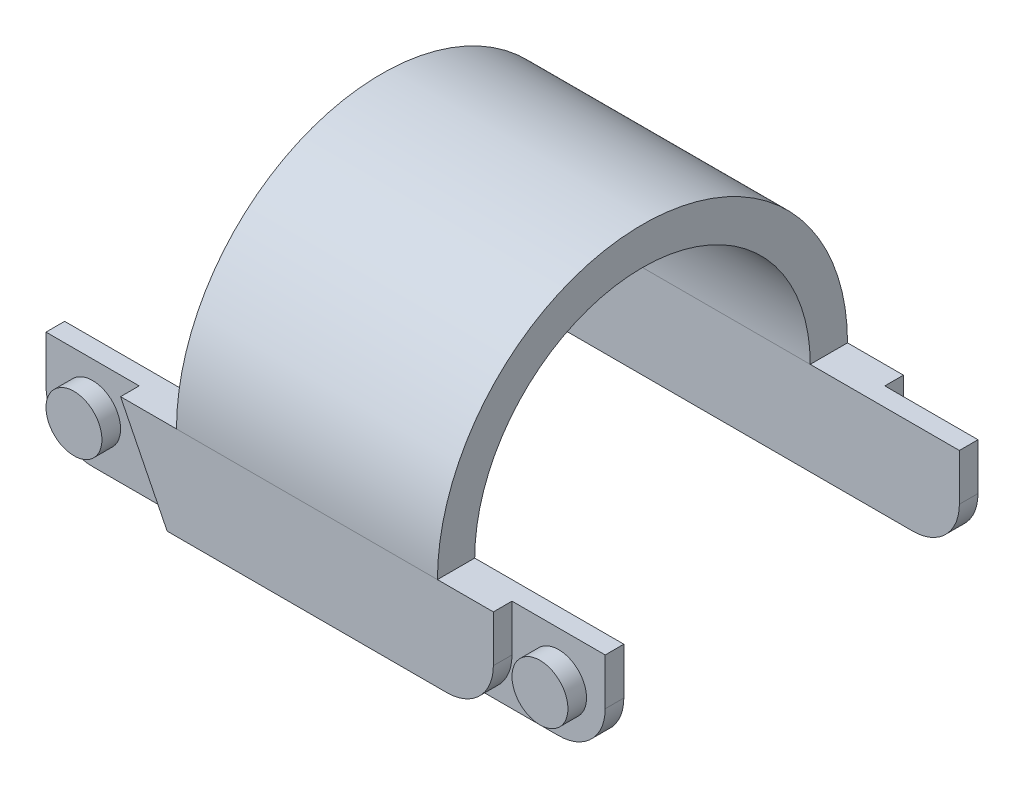
from build123d import *

# Parameters (mm, degrees)
SKETCH3_W             = 2
SKETCH3_H             = 5
BOSS_EXTRUDE1_DEPTH   = 30
BOSS_EXTRUDE1_2_DEPTH = 30
SKETCH4_W             = 5
SKETCH4_H             = 5
CUT_EXTRUDE1_DEPTH    = 1
SKETCH5_W             = 5
SKETCH5_H             = 5
CUT_EXTRUDE2_DEPTH    = 1
SWEEP1_START          = 8
SWEEP1_DEPTH          = 14
SKETCH7_R             = 1.5
BOSS_EXTRUDE2_DEPTH   = 1
BOSS_EXTRUDE3_START   = 1
SKETCH8_R             = 1.5
BOSS_EXTRUDE3_DEPTH   = 1
FILLET1_R             = 2.5
CUT_EXTRUDE3_DEPTH    = 1
CUT_EXTRUDE4_DEPTH    = 1
FILLET2_R             = 2.5


# Read off the part's stored shape, not the designer's step: Sweep1
with BuildPart() as part:
    # Sketch3 → Boss-Extrude1 (new body)
    with BuildSketch(Plane(origin=(0, 0, 0), x_dir=(0, 0, -1), z_dir=(1, 0, 0))):
        with Locations((-10, 0)):
            Rectangle(SKETCH3_W, SKETCH3_H)
    extrude(amount=BOSS_EXTRUDE1_DEPTH)

    # Sketch4 → Cut-Extrude1 (cut)
    with BuildSketch(Plane.XY.offset(11)):
        with Locations((2.5, 0)):
            Rectangle(SKETCH4_W, SKETCH4_H)
        with Locations((27.5, 0)):
            Rectangle(SKETCH4_W, SKETCH4_H)
    extrude(amount=-CUT_EXTRUDE1_DEPTH, mode=Mode.SUBTRACT)



with BuildPart() as body_2:
    # Sketch3 → Boss-Extrude1 2 (new body)
    with BuildSketch(Plane(origin=(0, 0, 0), x_dir=(0, 0, -1), z_dir=(1, 0, 0))):
        with Locations((10, 0)):
            Rectangle(SKETCH3_W, SKETCH3_H)
    extrude(amount=BOSS_EXTRUDE1_2_DEPTH)

    # Sketch5 → Cut-Extrude2 (cut)
    with BuildSketch(Plane(origin=(0, 0, -11), x_dir=(-1, 0, 0), z_dir=(0, 0, -1))):
        with Locations((-27.5, 0)):
            Rectangle(SKETCH5_W, SKETCH5_H)
        with Locations((-2.5, 0)):
            Rectangle(SKETCH5_W, SKETCH5_H)
    extrude(amount=-CUT_EXTRUDE2_DEPTH, mode=Mode.SUBTRACT)


with BuildPart() as part_1:
    add(part.part)

    add(body_2.part)  # Sweep1 merges body 2
    # Sweep1 outline → Sweep1 (add)
    with BuildSketch(Plane.YZ.offset(SWEEP1_START)):
        with BuildLine():
            Line((2.5, -9), (2.5, -11))
            ThreePointArc((2.5, -11), (13.5, 0), (2.5, 11))
            Line((2.5, 11), (2.5, 9))
            ThreePointArc((2.5, 9), (11.5, 0), (2.5, -9))
        make_face()
    extrude(amount=SWEEP1_DEPTH)

    # Sketch7 → Boss-Extrude2 (add)
    with BuildSketch(Plane(origin=(0, 0, -10), x_dir=(-1, 0, 0), z_dir=(0, 0, -1))):
        with Locations(Location((-2.5, 0, 0), (0, 0, 270))):
            Circle(SKETCH7_R)
        with Locations(Location((-27.5, 0, 0), (0, 0, 90))):
            Circle(SKETCH7_R)
    extrude(amount=BOSS_EXTRUDE2_DEPTH)

    # Sketch8 → Boss-Extrude3 (add)
    with BuildSketch(Plane.XY.offset(10).offset(BOSS_EXTRUDE3_START)):
        with Locations(Location((27.5, 0, 0), (0, 0, 90))):
            Circle(SKETCH8_R)
        with Locations(Location((2.5, 0, 0), (0, 0, 270))):
            Circle(SKETCH8_R)
    extrude(amount=-BOSS_EXTRUDE3_DEPTH)

    # Fillet1
    fillet1_edges = [part_1.edges().sort_by_distance(p)[0] for p in [
        (0, -2.5, 9.5),
        (30, -2.5, 9.5),
        (30, -2.5, -9.5),
        (0, -2.5, -9.5),
    ]]
    fillet(fillet1_edges, radius=FILLET1_R)

    # Sketch9 → Cut-Extrude3 (cut)
    with BuildSketch(Plane.XY.offset(11)):
        Polygon((5, 2.5), (7.5, -2.5), (5, -2.5), align=None)
    extrude(amount=-CUT_EXTRUDE3_DEPTH, mode=Mode.SUBTRACT)

    # Sketch10 → Cut-Extrude4 (cut)
    with BuildSketch(Plane(origin=(0, 0, -11), x_dir=(-1, 0, 0), z_dir=(0, 0, -1))):
        Polygon((-5, 2.5), (-7.5, -2.5), (-5, -2.5), align=None)
    extrude(amount=-CUT_EXTRUDE4_DEPTH, mode=Mode.SUBTRACT)

    # Fillet2
    fillet2_edges = [part_1.edges().sort_by_distance(p)[0] for p in [
        (25, -2.5, 10.5),
        (25, -2.5, -10.5),
    ]]
    fillet(fillet2_edges, radius=FILLET2_R)


solid = part_1.part
